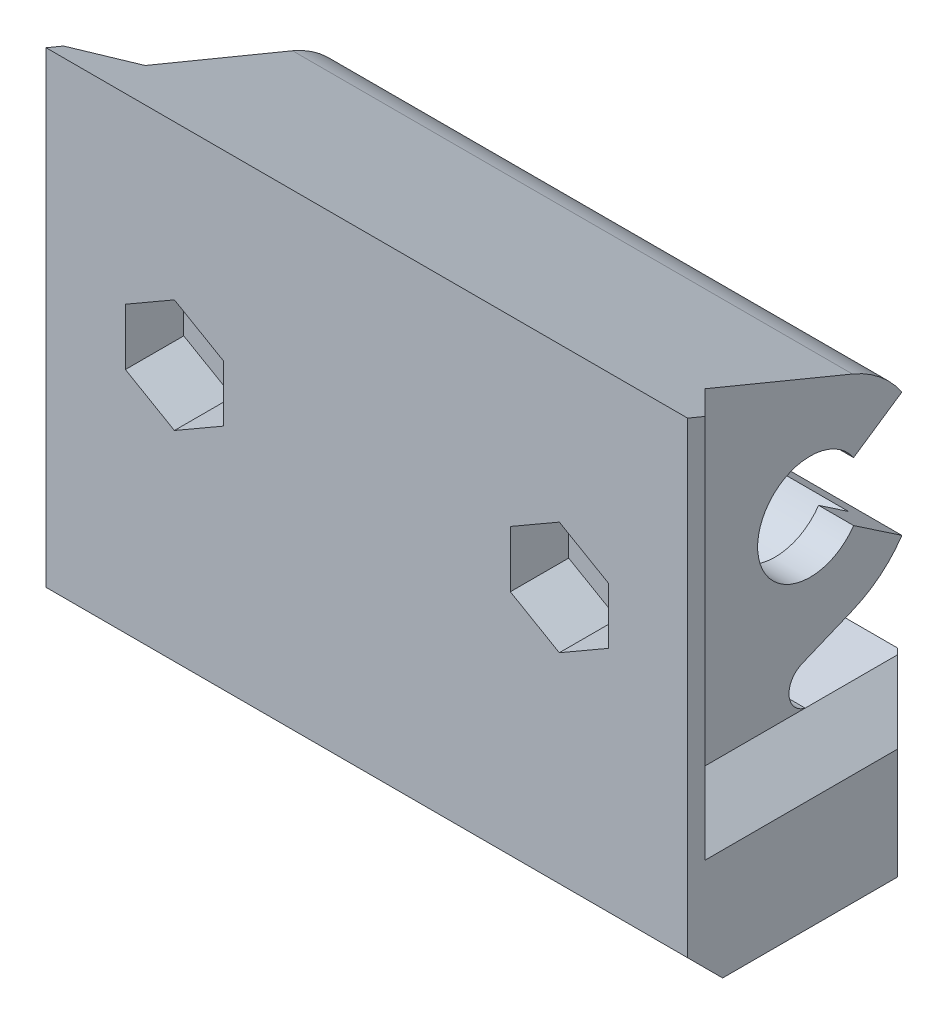
from build123d import *

# Parameters (mm, degrees)
SKETCH1_W           = 55
SKETCH1_H           = 45
BOSS_EXTRUDE1_DEPTH = 5
SKETCH3_W           = 55
SKETCH3_H           = 13
BOSS_EXTRUDE5_DEPTH = 20
CHAMFER1_SIZE       = 3
SKETCH5_R           = 4.2
CUT_EXTRUDE2_DEPTH  = 8
BOSS_EXTRUDE7_DEPTH = 48
CUT_EXTRUDE3_DEPTH  = 71.205777697
CHAMFER2_SIZE       = 3.5
CHAMFER3_SIZE       = 3.5
CHAMFER4_SIZE       = 7
BOSS_EXTRUDE8_START = -3
BOSS_EXTRUDE8_DEPTH = 3
CHAMFER5_SIZE       = 6
CUT_EXTRUDE4_DEPTH  = 5
SKETCH11_W          = 55
SKETCH11_H          = 13.699454105
CUT_EXTRUDE5_DEPTH  = 3


with BuildPart() as part:
    # Sketch1 → Boss-Extrude1 (new body)
    with BuildSketch(Plane.XY):
        with Locations((17.145774036, 16.279520652)):
            Rectangle(SKETCH1_W, SKETCH1_H)
    extrude(amount=BOSS_EXTRUDE1_DEPTH)

    # Sketch3 → Boss-Extrude5 (add)
    with BuildSketch(Plane(origin=(0, 0, 0), x_dir=(-1, 0, 0), z_dir=(0, 0, -1))):
        with Locations((-17.145774036, 0.279520652)):
            Rectangle(SKETCH3_W, SKETCH3_H)
    extrude(amount=BOSS_EXTRUDE5_DEPTH)

    # Chamfer1
    chamfer1_edges = [part.edges().sort_by_distance(p)[0] for p in [
        (17.145774036, -6.220479348, 5),
    ]]
    chamfer(chamfer1_edges, length=CHAMFER1_SIZE)

    # Sketch5 → Cut-Extrude2 (cut)
    with BuildSketch(Plane.XZ.offset(6.220479348)):
        with Locations(Location((-0.354225964, -7, 0), (0, 0, 270))):
            Circle(SKETCH5_R)
        with Locations(Location((34.645774036, -7, 0), (0, 0, 270))):
            Circle(SKETCH5_R)
    extrude(amount=-CUT_EXTRUDE2_DEPTH, mode=Mode.SUBTRACT)

    # Sketch7 → Boss-Extrude7 (add)
    with BuildSketch(Plane.ZY.offset(6.854225964)):
        with BuildLine():
            Line((-8.308177677, 10.21387745), (-12.629175087, 12.000050953))
            ThreePointArc((-12.629175087, 12.000050953), (-15.003318067, 13.416764905), (-16.86901604, 15.457060078))
            Line((-16.86901604, 15.457060078), (-15.295212832, 16.521552193))
            ThreePointArc((-15.295212832, 16.521552193), (-1.4, 20.779520652), (-15.295212832, 25.037489111))
            Line((-15.295212832, 25.037489111), (-16.86901604, 26.101981226))
            ThreePointArc((-16.86901604, 26.101981226), (-15.003318067, 28.142276398), (-12.629175087, 29.55899035))
            Line((-12.629175087, 29.55899035), (0, 34.779520652))
            Line((0, 34.779520652), (0, 6.779520652))
            Line((0, 6.779520652), (-8.576470695, 6.779520652))
            ThreePointArc((-8.576470695, 6.779520652), (-7.194534972, 8.39922137), (-8.308177677, 10.21387745))
        make_face()
    extrude(amount=-BOSS_EXTRUDE7_DEPTH)

    # Sketch8 → Cut-Extrude3 (cut, through all)
    with BuildSketch(Plane.ZY.offset(10.354225964)):
        Polygon((0, 34.779520652), (5, 36.846373896), (5, 38.779520652), (0, 38.779520652), align=None)
    extrude(amount=-CUT_EXTRUDE3_DEPTH, mode=Mode.SUBTRACT)

    # Chamfer2
    chamfer2_edges = [part.edges().sort_by_distance(p)[0] for p in [
        (-10.354225964, 6.779520652, -10),
        (-10.354225964, 20.779520652, 0),
    ]]
    chamfer(chamfer2_edges, length=CHAMFER2_SIZE - 0.0001)  # a hair under: the kernel refuses the full size

    # Chamfer3
    chamfer3_edges = [part.edges().sort_by_distance(p)[0] for p in [
        (44.645774036, 20.779520652, 0),
        (44.645774036, 6.779520652, -10),
    ]]
    chamfer(chamfer3_edges, length=CHAMFER3_SIZE - 0.0001)  # a hair under: the kernel refuses the full size

    # Chamfer4
    chamfer4_edges = [part.edges().sort_by_distance(p)[0] for p in [
        (44.645774036, -1.470429348, -20),
        (-10.354225964, -1.470429348, -20),
    ]]
    chamfer(chamfer4_edges, length=CHAMFER4_SIZE)

    # Sketch9 → Boss-Extrude8 (add)
    with BuildSketch(Plane(origin=(41.145774036, 0, 0), x_dir=(0, 0, -1), z_dir=(1, 0, 0)).offset(BOSS_EXTRUDE8_START)):
        with BuildLine():
            Line((15.295212832, 16.521552193), (12.727428651, 18.258355117))
            ThreePointArc((12.727428651, 18.258355117), (4.5, 20.779520652), (12.727428651, 23.300686187))
            Line((12.727428651, 23.300686187), (15.295212832, 25.037489111))
            ThreePointArc((15.295212832, 25.037489111), (1.4, 20.779520652), (15.295212832, 16.521552193))
        make_face()
    extrude(amount=BOSS_EXTRUDE8_DEPTH)

    # Chamfer5
    chamfer5_edges = [part.edges().sort_by_distance(p)[0] for p in [
        (17.145774036, -6.220479348, -20),
    ]]
    chamfer(chamfer5_edges, length=CHAMFER5_SIZE)

    # Sketch10 → Cut-Extrude4 (cut)
    with BuildSketch(Plane.XY.offset(5)):
        Polygon((33.645774036, 13.92977839), (37.845774036, 16.354649521), (37.845774036, 21.204391782), (33.645774036, 23.629262913), (29.445774036, 21.204391782), (29.445774036, 16.354649521), align=None)
        Polygon((0.645774036, 13.92977839), (4.845774036, 16.354649521), (4.845774036, 21.204391782), (0.645774036, 23.629262913), (-3.554225964, 21.204391782), (-3.554225964, 16.354649521), align=None)
    extrude(amount=-CUT_EXTRUDE4_DEPTH, mode=Mode.SUBTRACT)

    # Sketch11 → Cut-Extrude5 (cut)
    with BuildSketch(Plane(origin=(0, 0, -20), x_dir=(-1, 0, 0), z_dir=(0, 0, -1))):
        with Locations((-17.145774036, 0.629247705)):
            Rectangle(SKETCH11_W, SKETCH11_H)
    extrude(amount=-CUT_EXTRUDE5_DEPTH, mode=Mode.SUBTRACT)


solid = part.part
